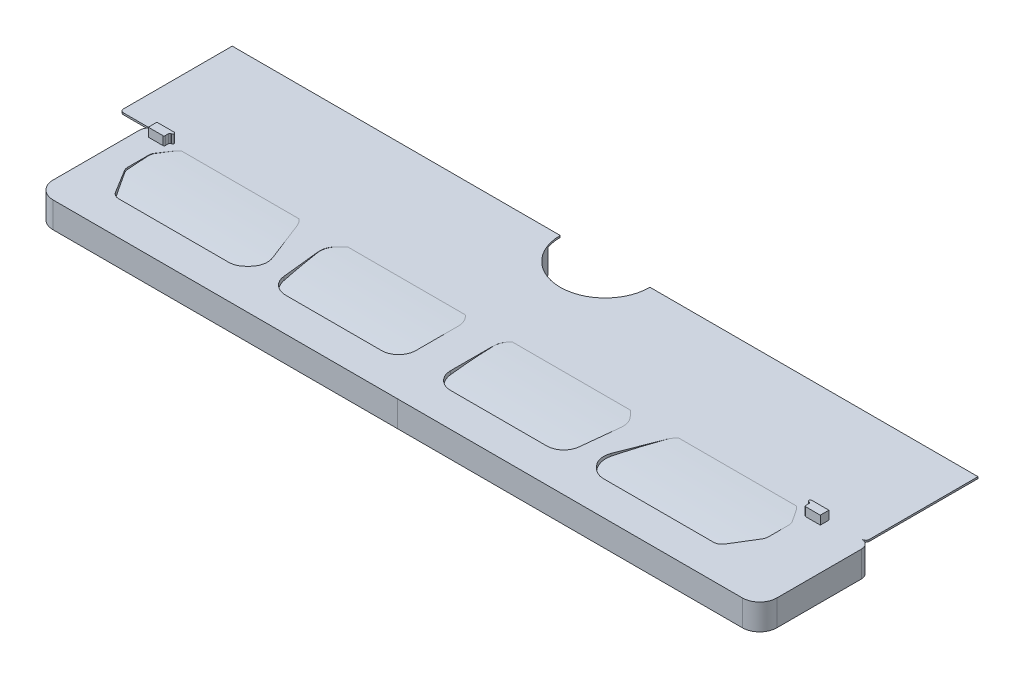
from build123d import *

# Parameters (mm, degrees)
BLADE_DEPTH             = 0.1
BLADE_DEPTH_BACK        = 4
CUT_EXTRUDE2_DEPTH      = 50.1
CUT_EXTRUDE2_DEPTH_BACK = 50.1
BOSS_EXTRUDE4_DEPTH     = 0.5
BOSS_EXTRUDE4_2_DEPTH   = 0.5
BOSS_EXTRUDE7_START     = -1.5
BOSS_EXTRUDE7_DEPTH     = 1.5


with BuildPart() as part:
    # blade geometry → blade (new, two sides: drawn at the far end of the back side and taken through both)
    with BuildSketch(Plane(origin=(0, 0, 0), x_dir=(1, 0, 0), z_dir=(0, 1, 0)).offset(-BLADE_DEPTH_BACK)):
        with BuildLine():
            ThreePointArc((-18.55, 0.3), (-18.462132034, 0.087867966), (-18.25, 0))
            Line((-18.25, 0), (18.25, 0))
            ThreePointArc((18.25, 0), (18.462132034, 0.087867966), (18.55, 0.3))
            Line((18.55, 0.3), (18.55, 4.519629257))
            ThreePointArc((18.55, 4.519629257), (18.529497475, 4.569126732), (18.48, 4.589629257))
            Line((18.48, 4.589629257), (18.463951547, 4.589629257))
            ThreePointArc((18.463951547, 4.589629257), (18.414454073, 4.610131783), (18.393951547, 4.659629257))
            Line((18.393951547, 4.659629257), (18.393951547, 4.68))
            ThreePointArc((18.393951547, 4.68), (18.414454073, 4.729497475), (18.463951547, 4.75))
            Line((18.463951547, 4.75), (21.4, 4.75))
            ThreePointArc((21.4, 4.75), (21.541421356, 4.808578644), (21.6, 4.95))
            Line((21.6, 4.95), (21.6, 11.25))
            Line((21.6, 11.25), (2.6, 11.25))
            ThreePointArc((2.6, 11.25), (0, 8.65), (-2.6, 11.25))
            Line((-2.6, 11.25), (-21.6, 11.25))
            Line((-21.6, 11.25), (-21.6, 4.95))
            ThreePointArc((-21.6, 4.95), (-21.541421356, 4.808578644), (-21.4, 4.75))
            Line((-21.4, 4.75), (-18.463951547, 4.75))
            ThreePointArc((-18.463951547, 4.75), (-18.414454073, 4.729497475), (-18.393951547, 4.68))
            Line((-18.393951547, 4.68), (-18.393951547, 4.659629257))
            ThreePointArc((-18.393951547, 4.659629257), (-18.414454073, 4.610131783), (-18.463951547, 4.589629257))
            Line((-18.463951547, 4.589629257), (-18.48, 4.589629257))
            ThreePointArc((-18.48, 4.589629257), (-18.529497475, 4.569126732), (-18.55, 4.519629257))
            Line((-18.55, 4.519629257), (-18.55, 0.3))
        make_face()
    extrude(amount=BLADE_DEPTH + BLADE_DEPTH_BACK)

    # blade bend cut → Cut-Extrude2 (cut, two sides: drawn at the far end of the back side and taken through both)
    with BuildSketch(Plane(origin=(18.55, 0, 0), x_dir=(0, 0, -1), z_dir=(1, 0, 0)).offset(-CUT_EXTRUDE2_DEPTH_BACK)):
        with BuildLine():
            Line((4.519629257, 0), (11.25, 0))
            Line((11.25, 0), (11.25, -4))
            Line((11.25, -4), (0, -4))
            Line((0, -4), (0, 0.1))
            Line((0, 0.1), (4.519629257, 0.1))
            ThreePointArc((4.519629257, 0.1), (2.259628554, 0.001326238), (0.016827821, -0.29394408))
            Line((0.016827821, -0.29394408), (0.016827821, -0.39394408))
            ThreePointArc((0.016827821, -0.39394408), (2.259628554, -0.098673762), (4.519629257, 0))
        make_face()
    extrude(amount=CUT_EXTRUDE2_DEPTH + CUT_EXTRUDE2_DEPTH_BACK, mode=Mode.SUBTRACT)



with BuildPart() as body_2:
    # pill → Boss-Extrude4 (new body)
    with BuildSketch(Plane(origin=(0, 0.1, 0), x_dir=(1, 0, 0), z_dir=(0, 1, 0))):
        with BuildLine():
            Line((19.463951547, 4.75), (18.463951547, 4.75))
            ThreePointArc((18.463951547, 4.75), (18.414454073, 4.729497475), (18.393951547, 4.68))
            Line((18.393951547, 4.68), (18.393951547, 4.659629257))
            ThreePointArc((18.393951547, 4.659629257), (18.414454073, 4.610131783), (18.463951547, 4.589629257))
            Line((18.463951547, 4.589629257), (18.48, 4.589629257))
            ThreePointArc((18.48, 4.589629257), (18.529497475, 4.569126732), (18.55, 4.519629257))
            Line((18.55, 4.519629257), (18.55, 4.32))
            ThreePointArc((18.55, 4.32), (18.570502525, 4.270502525), (18.62, 4.25))
            Line((18.62, 4.25), (19.463951547, 4.25))
            Line((19.463951547, 4.25), (19.463951547, 4.75))
        make_face()
    extrude(amount=BOSS_EXTRUDE4_DEPTH)


with BuildPart() as body_3:
    # pill → Boss-Extrude4 2 (new body)
    with BuildSketch(Plane(origin=(0, 0.1, 0), x_dir=(1, 0, 0), z_dir=(0, 1, 0))):
        with BuildLine():
            Line((-19.463951547, 4.75), (-19.463951547, 4.25))
            Line((-19.463951547, 4.25), (-18.62, 4.25))
            ThreePointArc((-18.62, 4.25), (-18.570502525, 4.270502525), (-18.55, 4.32))
            Line((-18.55, 4.32), (-18.55, 4.519629257))
            ThreePointArc((-18.55, 4.519629257), (-18.529497475, 4.569126732), (-18.48, 4.589629257))
            Line((-18.48, 4.589629257), (-18.463951547, 4.589629257))
            ThreePointArc((-18.463951547, 4.589629257), (-18.414454073, 4.610131783), (-18.393951547, 4.659629257))
            Line((-18.393951547, 4.659629257), (-18.393951547, 4.68))
            ThreePointArc((-18.393951547, 4.68), (-18.414454073, 4.729497475), (-18.463951547, 4.75))
            Line((-18.463951547, 4.75), (-19.463951547, 4.75))
        make_face()
    extrude(amount=BOSS_EXTRUDE4_2_DEPTH)


with BuildPart() as part_1:
    add(part.part)

    add(body_2.part)  # Boss-Extrude7 merges body 2

    add(body_3.part)  # Boss-Extrude7 merges body 3
    # Base plate → Boss-Extrude7 (add)
    with BuildSketch(Plane(origin=(0, 0.1, 0), x_dir=(1, 0, 0), z_dir=(0, 1, 0)).offset(BOSS_EXTRUDE7_START)):
        with BuildLine():
            ThreePointArc((-19.570022254, 4.843495754), (-19.923584959, 4.697071633), (-20.070054057, 4.343527558))
            Line((-20.070054057, 4.343527558), (-20.070372095, -0.656472431))
            ThreePointArc((-20.070372095, -0.656472431), (-19.777523854, -1.363597841), (-19.070435705, -1.656536037))
            Line((-19.070435705, -1.656536037), (0.893899181, -1.657805922))
            Line((0.893899181, -1.657805922), (20.858234107, -1.657805922))
            ThreePointArc((20.858234107, -1.657805922), (21.565340888, -1.364912703), (21.858234107, -0.657805922))
            Line((21.858234107, -0.657805922), (21.858234107, 4.25))
            ThreePointArc((21.858234107, 4.25), (21.711787498, 4.603553391), (21.358234107, 4.75))
            Line((21.358234107, 4.75), (19.463951547, 4.75))
            ThreePointArc((19.463951547, 4.75), (18.756844766, 5.042893219), (18.463951547, 5.75))
            Line((18.463951547, 5.75), (18.463951547, 10.396684397))
            Line((18.463951547, 10.396684397), (2.455982997, 10.396684397))
            ThreePointArc((2.455982997, 10.396684397), (-0.0001128, 8.650000002), (-2.45605703, 10.396897505))
            Line((-2.45605703, 10.396897505), (-17.56966895, 10.397858846))
            Line((-17.56966895, 10.397858846), (-17.56995865, 5.843368536))
            ThreePointArc((-17.56995865, 5.843368536), (-17.862896846, 5.136280387), (-18.570022256, 4.843432146))
            Line((-18.570022256, 4.843432146), (-19.570022254, 4.843495754))
        make_face()
        with BuildLine():
            ThreePointArc((17.18082873, 4.75), (17.651272332, 4.632430064), (18.011095885, 4.307365635))
            Line((18.011095885, 4.307365635), (18.465133578, 3.631018621))
            ThreePointArc((18.465133578, 3.631018621), (18.528313072, 3.497995014), (18.55, 3.352335803))
            Line((18.55, 3.352335803), (18.55, 2.145789668))
            ThreePointArc((18.55, 2.145789668), (18.531183389, 2.009912717), (18.476149817, 1.884262741))
            Line((18.476149817, 1.884262741), (17.650242536, 0.538473073))
            ThreePointArc((17.650242536, 0.538473073), (17.468261244, 0.363672449), (17.224092719, 0.3))
            Line((17.224092719, 0.3), (10.870366616, 0.3))
            ThreePointArc((10.870366616, 0.3), (10.487683183, 0.376120467), (10.163259834, 0.592893219))
            Line((10.163259834, 0.592893219), (10.03330995, 0.722843103))
            ThreePointArc((10.03330995, 0.722843103), (9.761890711, 1.223826553), (9.808152704, 1.791728524))
            Line((9.808152704, 1.791728524), (10.708481955, 4.111778639))
            ThreePointArc((10.708481955, 4.111778639), (11.075847159, 4.575160178), (11.640745982, 4.75))
            Line((11.640745982, 4.75), (17.18082873, 4.75))
        make_face(mode=Mode.SUBTRACT)
        with BuildLine():
            Line((7.956153053, 4.75), (8.501671849, 4.204481204))
            ThreePointArc((8.501671849, 4.204481204), (8.737625541, 3.829995745), (8.788820951, 3.390345277))
            Line((8.788820951, 3.390345277), (8.55227912, 1.192970854))
            ThreePointArc((8.55227912, 1.192970854), (8.226218887, 0.5560144), (7.558023237, 0.3))
            Line((7.558023237, 0.3), (2.006153053, 0.3))
            ThreePointArc((2.006153053, 0.3), (1.299046272, 0.592893219), (1.006153053, 1.3))
            Line((1.006153053, 1.3), (1.006153053, 3.75))
            ThreePointArc((1.006153053, 3.75), (1.299046272, 4.457106781), (2.006153053, 4.75))
            Line((2.006153053, 4.75), (7.956153053, 4.75))
        make_face(mode=Mode.SUBTRACT)
        with BuildLine():
            ThreePointArc((-2.006506357, 4.750127618), (-1.299418208, 4.457189422), (-1.006569967, 3.750064012))
            Line((-1.006569967, 3.750064012), (-1.006725806, 1.300064017))
            ThreePointArc((-1.006725806, 1.300064017), (-1.299664001, 0.592975868), (-2.006789411, 0.300127627))
            Line((-2.006789411, 0.300127627), (-7.558659584, 0.300480768))
            ThreePointArc((-7.558659584, 0.300480768), (-8.226838948, 0.55653767), (-8.552858665, 1.193514863))
            Line((-8.552858665, 1.193514863), (-8.789260726, 3.390904328))
            ThreePointArc((-8.789260726, 3.390904328), (-8.738037351, 3.830551538), (-8.502059839, 4.205021988))
            Line((-8.502059839, 4.205021988), (-7.956506345, 4.750506084))
            Line((-7.956506345, 4.750506084), (-2.006506357, 4.750127618))
        make_face(mode=Mode.SUBTRACT)
        with BuildLine():
            ThreePointArc((-11.641099267, 4.750740452), (-11.076211566, 4.575864698), (-10.708875837, 4.112459793))
            Line((-10.708875837, 4.112459793), (-9.808694161, 1.792352415))
            ThreePointArc((-9.808694161, 1.792352415), (-9.762468291, 1.224447503), (-10.033919396, 0.723481318))
            Line((-10.033919396, 0.723481318), (-10.163877546, 0.5935397))
            ThreePointArc((-10.163877546, 0.5935397), (-10.488314682, 0.376787585), (-10.871002956, 0.300691459))
            Line((-10.871002956, 0.300691459), (-17.224729047, 0.301095604))
            ThreePointArc((-17.224729047, 0.301095604), (-17.46889352, 0.364783584), (-17.650863694, 0.539595783))
            Line((-17.650863694, 0.539595783), (-18.47668537, 1.885437982))
            ThreePointArc((-18.47668537, 1.885437982), (-18.531710951, 2.011091459), (-18.550518918, 2.146969606))
            Line((-18.550518918, 2.146969606), (-18.550442173, 3.353515739))
            ThreePointArc((-18.550442173, 3.353515739), (-18.528745979, 3.49917357), (-18.465558024, 3.632193158))
            Line((-18.465558024, 3.632193158), (-18.011477312, 4.308511291))
            ThreePointArc((-18.011477312, 4.308511291), (-17.651633082, 4.633552831), (-17.181182003, 4.751092844))
            Line((-17.181182003, 4.751092844), (-11.641099267, 4.750740452))
        make_face(mode=Mode.SUBTRACT)
    extrude(amount=BOSS_EXTRUDE7_DEPTH)


solid = part_1.part
